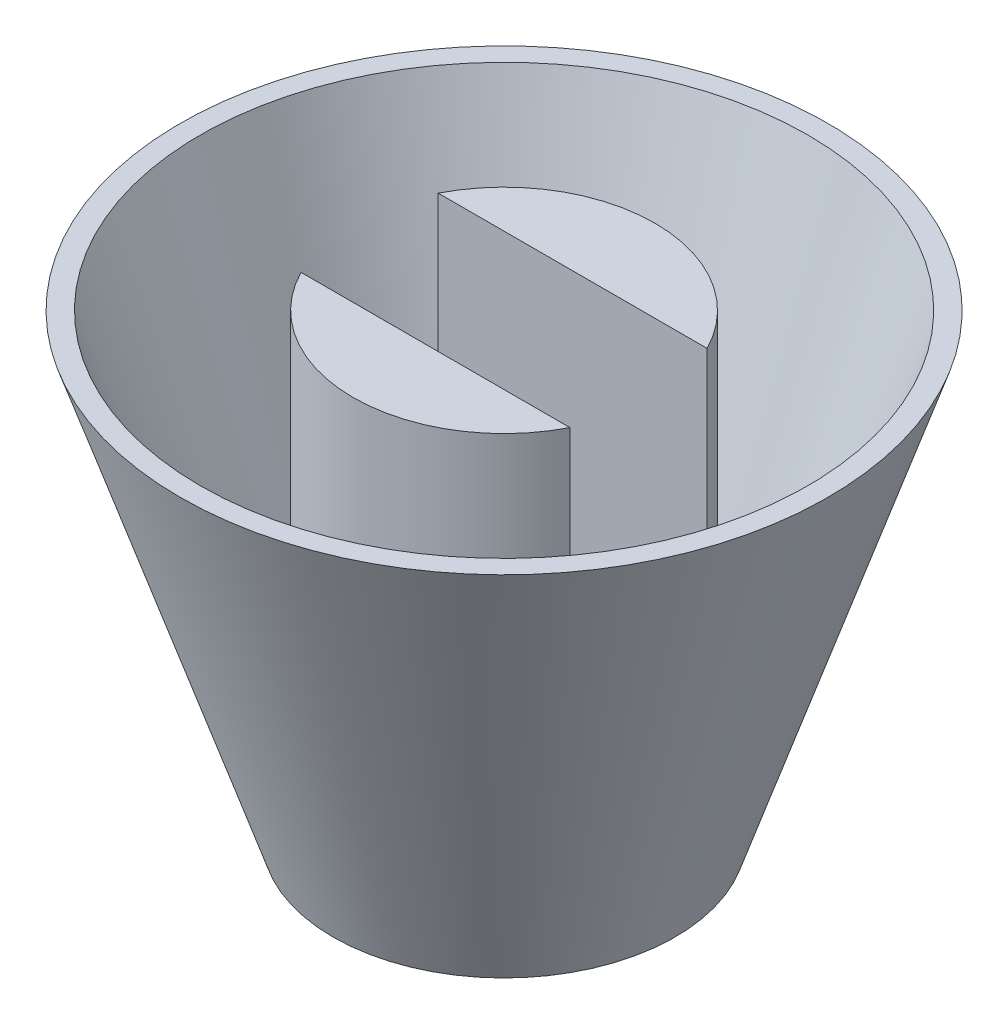
from build123d import *

# Parameters (mm, degrees)
SKETCH1_R             = 42.5
BOSS_EXTRUDE1_DEPTH   = 60
BOSS_EXTRUDE1_DRAFT   = -18.485
SHELL1_T              = -2.5
BOSS_EXTRUDE2_DEPTH   = 60
BOSS_EXTRUDE2_2_DEPTH = 60


with BuildPart() as part:
    # Sketch1 → Boss-Extrude1 (with draft: the straight prism first)
    with BuildSketch(Plane(origin=(0, 0, 0), x_dir=(1, 0, 0), z_dir=(0, 1, 0))):
        Circle(SKETCH1_R)
    extrude(amount=-BOSS_EXTRUDE1_DEPTH)
    # Boss-Extrude1: the draft: its side faces are tilted about the plane it starts from
    boss_extrude1_sides = [part.faces().sort_by_distance(p)[0] for p in [
        (-42.5, -30, 0),
    ]]
    draft(boss_extrude1_sides, Plane(origin=(0, 0, 0), x_dir=(1, 0, 0), z_dir=(0, 1, 0)), BOSS_EXTRUDE1_DRAFT)

    # Shell1
    shell1_openings = [part.faces().sort_by_distance(p)[0] for p in [
        (0, 0, 0),
        (0, -60, 0),
    ]]
    offset(amount=SHELL1_T, openings=shell1_openings, kind=Kind.INTERSECTION)


with BuildPart() as body_2:
    # Sketch2 → Boss-Extrude2 (new body)
    with BuildSketch(Plane.XZ.offset(60)):
        with BuildLine():
            Line((-17.642776703, 9), (17.642776703, 9))
            ThreePointArc((17.642776703, 9), (0, 19.805745878), (-17.642776703, 9))
        make_face()
    extrude(amount=-BOSS_EXTRUDE2_DEPTH)


with BuildPart() as body_3:
    # Sketch2 → Boss-Extrude2 2 (new body)
    with BuildSketch(Plane.XZ.offset(60)):
        with BuildLine():
            Line((-17.642776703, -9), (17.642776703, -9))
            ThreePointArc((17.642776703, -9), (0, -19.805745878), (-17.642776703, -9))
        make_face()
    extrude(amount=-BOSS_EXTRUDE2_2_DEPTH)


solid = Compound([part.part, body_2.part, body_3.part])
